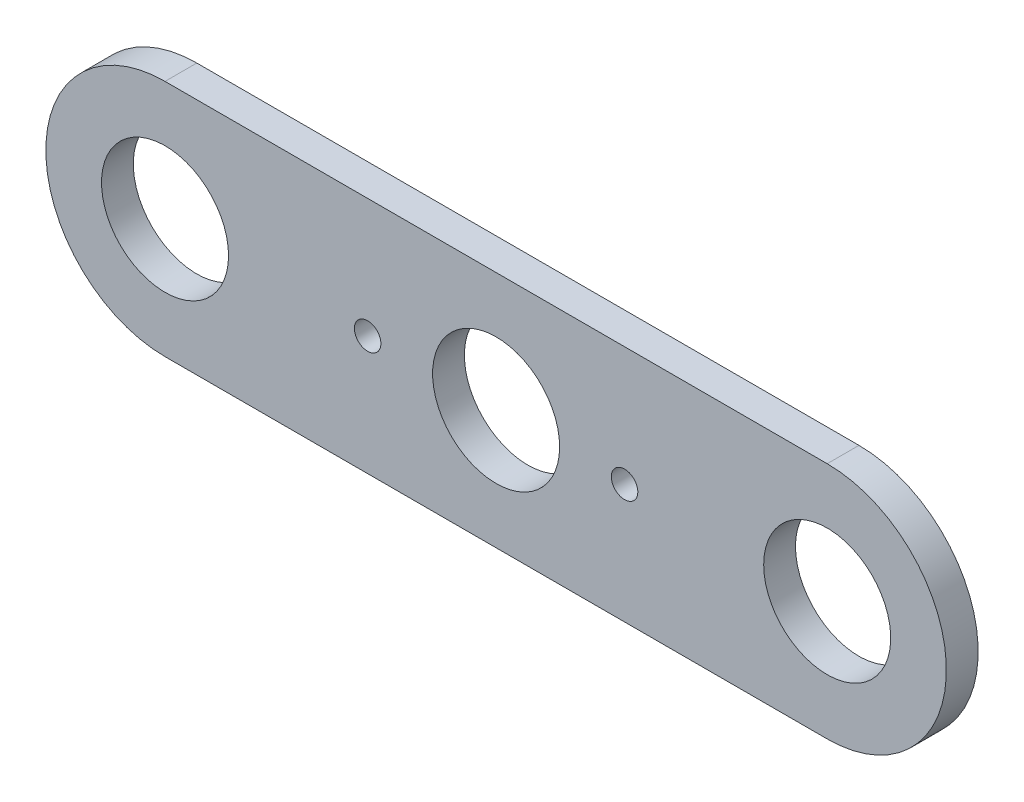
from build123d import *

# Parameters (mm, degrees)
SKETCH2_R           = 11.99
BOSS_EXTRUDE1_DEPTH = 6
SKETCH3_R           = 2.5
CUT_EXTRUDE1_DEPTH  = 10


with BuildPart() as part:
    # Sketch2 → Boss-Extrude1 (new body)
    with BuildSketch(Plane.XY):
        with BuildLine():
            Line((-62.5, -22.5), (62.5, -22.5))
            ThreePointArc((62.5, -22.5), (85, 0), (62.5, 22.5))
            Line((62.5, 22.5), (-62.5, 22.5))
            ThreePointArc((-62.5, 22.5), (-85, 0), (-62.5, -22.5))
        make_face()
        with Locations((-62.5, 0)):
            Circle(SKETCH2_R, mode=Mode.SUBTRACT)
        with Locations((62.5, 0)):
            Circle(SKETCH2_R, mode=Mode.SUBTRACT)
        Circle(SKETCH2_R, mode=Mode.SUBTRACT)
    extrude(amount=BOSS_EXTRUDE1_DEPTH)

    # Sketch3 → Cut-Extrude1 (cut)
    with BuildSketch(Plane.XY.offset(6)):
        with Locations((-24.25, 0)):
            Circle(SKETCH3_R)
        with Locations((24.25, 0)):
            Circle(SKETCH3_R)
    extrude(amount=-CUT_EXTRUDE1_DEPTH, mode=Mode.SUBTRACT)


solid = part.part
